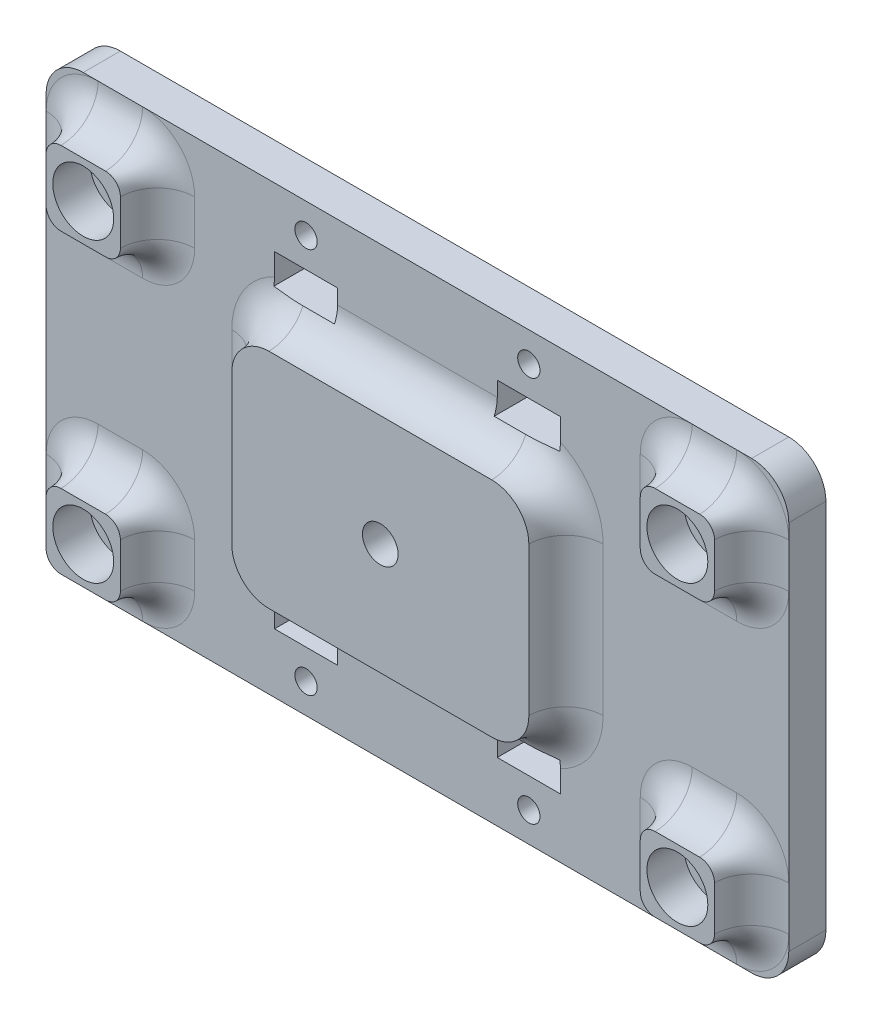
from build123d import *

# Parameters (mm, degrees)
SKETCH1_R           = 2.2500000000000027
SKETCH1_R_2         = 5
BOSS_EXTRUDE1_DEPTH = 5
SKETCH2_W           = 8.5
SKETCH2_H           = 4
CUT_EXTRUDE1_DEPTH  = 5
BOSS_EXTRUDE2_DEPTH = 5
SKETCH4_R           = 4.1000000000000005
CUT_EXTRUDE2_DEPTH  = 5
BOSS_EXTRUDE3_DEPTH = 5
SKETCH6_R           = 2.4
CUT_EXTRUDE3_DEPTH  = 5
FILLET1_R           = 5
SKETCH8_R           = 1.5000000000000009
SKETCH8_R_2         = 1.5000000000000042
SKETCH8_R_3         = 1.4999999999999973
CUT_EXTRUDE4_DEPTH  = 5


with BuildPart() as part:
    # Sketch1 → Boss-Extrude1 (new body)
    with BuildSketch(Plane.XY):
        with BuildLine():
            Line((-44.99999999999997, -30.000000000000004), (44.99999999999996, -30.000000000000004))
            ThreePointArc((44.99999999999996, -30.000000000000004), (48.53553390593273, -28.535533905932738), (49.99999999999999, -24.999999999999968))
            Line((49.99999999999999, -24.999999999999968), (49.99999999999999, 24.99999999999996))
            ThreePointArc((49.99999999999999, 24.99999999999996), (48.53553390593273, 28.53553390593273), (44.99999999999996, 29.999999999999996))
            Line((44.99999999999996, 29.999999999999996), (-44.99999999999997, 29.999999999999996))
            ThreePointArc((-44.99999999999997, 29.999999999999996), (-48.535533905932745, 28.535533905932727), (-50.00000000000001, 24.99999999999996))
            Line((-50.00000000000001, 24.99999999999996), (-50.00000000000001, -24.999999999999968))
            ThreePointArc((-50.00000000000001, -24.999999999999968), (-48.53553390593275, -28.535533905932745), (-44.99999999999997, -30.000000000000004))
        make_face()
        with Locations((-40.000000000000014, 19.999999999999993)):
            Circle(SKETCH1_R, mode=Mode.SUBTRACT)
        with Locations(Location((39.999999999999986, 19.999999999999993, 0), (0, 0, 180))):
            Circle(SKETCH1_R, mode=Mode.SUBTRACT)
        with Locations((39.999999999999986, -20.000000000000007)):
            Circle(SKETCH1_R, mode=Mode.SUBTRACT)
        with Locations(Location((-40.000000000000014, -20.000000000000007, 0), (0, 0, 180))):
            Circle(SKETCH1_R, mode=Mode.SUBTRACT)
        Circle(SKETCH1_R_2, mode=Mode.SUBTRACT)
    extrude(amount=BOSS_EXTRUDE1_DEPTH)

    # Sketch2 → Cut-Extrude1 (cut)
    with BuildSketch(Plane.XY.offset(5)):
        Polygon((10.750000000000002, -17.999999999999993), (19.250000000000007, -17.999999999999986), (19.250000000000007, -21.999999999999986), (10.750000000000005, -21.999999999999993), align=None)
        Polygon((-19.25, 19.999999999999993), (-19.25, 21.999999999999993), (-10.75, 21.999999999999993), (-10.75, 19.999999999999993), (-10.75, 17.999999999999996), (-19.25, 17.999999999999996), align=None)
        with Locations((15, 19.999999999999993)):
            Rectangle(SKETCH2_W, SKETCH2_H)
        Polygon((-19.249999999999993, -18.000000000000004), (-19.249999999999993, -20), (-19.249999999999993, -22), (-10.749999999999993, -21.999999999999993), (-10.749999999999996, -19.999999999999993), (-10.749999999999996, -17.999999999999996), align=None)
    extrude(amount=-CUT_EXTRUDE1_DEPTH, mode=Mode.SUBTRACT)

    # Sketch3 → Boss-Extrude2 (add)
    with BuildSketch(Plane.XY.offset(5)):
        with BuildLine():
            Line((-43, 14.999999999999998), (-37.00000000000003, 14.999999999999998))
            ThreePointArc((-37.00000000000003, 14.999999999999998), (-35.58578643762692, 15.585786437626902), (-35.00000000000001, 17.00000000000001))
            Line((-35.00000000000001, 17.00000000000001), (-35.00000000000001, 22.999999999999982))
            ThreePointArc((-35.00000000000001, 22.999999999999982), (-35.585786437626915, 24.4142135623731), (-37.00000000000003, 24.999999999999996))
            Line((-37.00000000000003, 24.999999999999996), (-43, 24.999999999999996))
            ThreePointArc((-43, 24.999999999999996), (-44.414213562373114, 24.414213562373096), (-45.000000000000014, 22.999999999999982))
            Line((-45.000000000000014, 22.999999999999982), (-45.000000000000014, 17.00000000000001))
            ThreePointArc((-45.000000000000014, 17.00000000000001), (-44.41421356237311, 15.585786437626904), (-43, 14.999999999999998))
        make_face()
        with BuildLine():
            Line((42.999999999999986, -15.000000000000005), (37.000000000000014, -15.000000000000005))
            ThreePointArc((37.000000000000014, -15.000000000000005), (35.58578643762691, -15.58578643762691), (34.99999999999999, -17.000000000000018))
            Line((34.99999999999999, -17.000000000000018), (34.99999999999999, -22.99999999999999))
            ThreePointArc((34.99999999999999, -22.99999999999999), (35.5857864376269, -24.414213562373106), (37.000000000000014, -25.000000000000004))
            Line((37.000000000000014, -25.000000000000004), (42.999999999999986, -25.000000000000004))
            ThreePointArc((42.999999999999986, -25.000000000000004), (44.4142135623731, -24.4142135623731), (45, -22.99999999999999))
            Line((45, -22.99999999999999), (45, -17.000000000000018))
            ThreePointArc((45, -17.000000000000018), (44.41421356237309, -15.58578643762691), (42.999999999999986, -15.000000000000005))
        make_face()
        with BuildLine():
            Line((34.99999999999999, 17.00000000000001), (34.99999999999999, 22.999999999999982))
            ThreePointArc((34.99999999999999, 22.999999999999982), (35.5857864376269, 24.4142135623731), (37.000000000000014, 24.999999999999996))
            Line((37.000000000000014, 24.999999999999996), (42.999999999999986, 24.999999999999996))
            ThreePointArc((42.999999999999986, 24.999999999999996), (44.4142135623731, 24.414213562373092), (45, 22.999999999999982))
            Line((45, 22.999999999999982), (45, 17.00000000000001))
            ThreePointArc((45, 17.00000000000001), (44.41421356237309, 15.585786437626902), (42.999999999999986, 14.999999999999998))
            Line((42.999999999999986, 14.999999999999998), (37.000000000000014, 14.999999999999998))
            ThreePointArc((37.000000000000014, 14.999999999999998), (35.58578643762691, 15.585786437626902), (34.99999999999999, 17.00000000000001))
        make_face()
        with BuildLine():
            Line((-35.00000000000001, -17.000000000000018), (-35.00000000000001, -22.99999999999999))
            ThreePointArc((-35.00000000000001, -22.99999999999999), (-35.585786437626915, -24.414213562373106), (-37.00000000000003, -25.000000000000004))
            Line((-37.00000000000003, -25.000000000000004), (-43, -25.000000000000004))
            ThreePointArc((-43, -25.000000000000004), (-44.414213562373114, -24.414213562373103), (-45.000000000000014, -22.99999999999999))
            Line((-45.000000000000014, -22.99999999999999), (-45.000000000000014, -17.000000000000018))
            ThreePointArc((-45.000000000000014, -17.000000000000018), (-44.41421356237311, -15.585786437626911), (-43, -15.000000000000005))
            Line((-43, -15.000000000000005), (-37.00000000000003, -15.000000000000005))
            ThreePointArc((-37.00000000000003, -15.000000000000005), (-35.58578643762692, -15.58578643762691), (-35.00000000000001, -17.000000000000018))
        make_face()
    extrude(amount=BOSS_EXTRUDE2_DEPTH)

    # Sketch4 → Cut-Extrude2 (cut)
    with BuildSketch(Plane.XY.offset(10)):
        with Locations((-40.00000000000001, 19.99999999999999)):
            Circle(SKETCH4_R)
        with Locations((39.99999999999999, 19.99999999999999)):
            Circle(SKETCH4_R)
        with Locations((39.99999999999999, -19.999999999999996)):
            Circle(SKETCH4_R)
        with Locations((-40.00000000000001, -19.999999999999996)):
            Circle(SKETCH4_R)
    extrude(amount=-CUT_EXTRUDE2_DEPTH, mode=Mode.SUBTRACT)

    # Sketch5 → Boss-Extrude3 (add)
    with BuildSketch(Plane.XY.offset(5)):
        with BuildLine():
            Line((-14.999999999999964, -14.999999999999998), (14.999999999999964, -14.999999999999998))
            ThreePointArc((14.999999999999964, -14.999999999999998), (18.535533905932738, -13.535533905932736), (20, -9.999999999999963))
            Line((20, -9.999999999999963), (20, 9.999999999999966))
            ThreePointArc((20, 9.999999999999966), (18.535533905932738, 13.53553390593274), (14.999999999999964, 15.000000000000002))
            Line((14.999999999999964, 15.000000000000002), (-14.999999999999964, 15.000000000000002))
            ThreePointArc((-14.999999999999964, 15.000000000000002), (-18.535533905932738, 13.535533905932738), (-20, 9.999999999999966))
            Line((-20, 9.999999999999966), (-20, -9.999999999999963))
            ThreePointArc((-20, -9.999999999999963), (-18.535533905932738, -13.535533905932736), (-14.999999999999964, -14.999999999999998))
        make_face()
    extrude(amount=BOSS_EXTRUDE3_DEPTH)

    # Sketch6 → Cut-Extrude3 (cut)
    with BuildSketch(Plane.XY.offset(10)):
        Circle(SKETCH6_R)
    extrude(amount=-CUT_EXTRUDE3_DEPTH, mode=Mode.SUBTRACT)

    # Fillet1
    # the kernel refuses this fillet: 5 mm, written as the material it adds along each edge
    with BuildSketch(Plane(origin=(37.00000000000001, 17.000000000000018, 5), x_dir=(3.55e-15, -1, 0), z_dir=(1, 3.55e-15, 0))) as fillet1_piece_1:
        with BuildLine():
            CenterArc((2.0000000000000178 + FILLET1_R, -FILLET1_R), FILLET1_R, 90, 90)
            Line((2.0000000000000178, -FILLET1_R), (2.0000000000000178, 0))
            Line((2.0000000000000178, 0), (2.0000000000000178 + FILLET1_R, 0))
        make_face()
    revolve(axis=Axis((37.00000000000001, 17.000000000000018, 5), (0, 0, -1)), revolution_arc=90)
    with BuildSketch(Plane(origin=(34.99999999999999, 17.00000000000001, 5), x_dir=(-1, 0, 0), z_dir=(0, 1, 0)), Plane(origin=(37.000000000000014, 24.999999999999996, 5), x_dir=(0, 1, 0), z_dir=(1, 0, 0)), Plane(origin=(45, 22.999999999999982, 5), x_dir=(1, 0, 0), z_dir=(0, -1, 0)), Plane(origin=(-45.000000000000014, -22.99999999999999, 5), x_dir=(-1, 0, 0), z_dir=(0, 1, 0)), Plane(origin=(-35.00000000000001, -17.000000000000018, 5), x_dir=(1, 0, 0), z_dir=(0, -1, 0)), Plane(origin=(-37.00000000000003, -25.000000000000004, 5), x_dir=(0, -1, 0), z_dir=(-1, 0, 0))) as fillet1_piece_2:
        with BuildLine():
            CenterArc((FILLET1_R, FILLET1_R), FILLET1_R, 180, 90)
            Line((0, FILLET1_R), (0, 0))
            Line((0, 0), (FILLET1_R, 0))
        make_face()
    extrude(amount=5.999999999999972)
    with BuildSketch(Plane(origin=(36.999999999999986, 23, 5), x_dir=(-1, -8.88e-15, 0), z_dir=(8.88e-15, -1, 0))) as fillet1_piece_3:
        with BuildLine():
            CenterArc((1.999999999999993 + FILLET1_R, -FILLET1_R), FILLET1_R, 90, 90)
            Line((1.999999999999993, -FILLET1_R), (1.999999999999993, 0))
            Line((1.999999999999993, 0), (1.999999999999993 + FILLET1_R, 0))
        make_face()
    revolve(axis=Axis((36.999999999999986, 23, 5), (0, 0, -1)), revolution_arc=90.00000000000132)
    with BuildSketch(Plane(origin=(43, 23.000000000000004, 5), x_dir=(-7.11e-15, 1, 0), z_dir=(-1, -7.11e-15, 0))) as fillet1_piece_4:
        with BuildLine():
            CenterArc((1.9999999999999964 + FILLET1_R, -FILLET1_R), FILLET1_R, 90, 90)
            Line((1.9999999999999964, -FILLET1_R), (1.9999999999999964, 0))
            Line((1.9999999999999964, 0), (1.9999999999999964 + FILLET1_R, 0))
        make_face()
    revolve(axis=Axis((43, 23.000000000000004, 5), (0, 0, -1)), revolution_arc=90.00000000000102)
    with BuildSketch(Plane(origin=(42.99999999999999, 17.000000000000004, 5), x_dir=(1, 3.55e-15, 0), z_dir=(-3.55e-15, 1, 0))) as fillet1_piece_5:
        with BuildLine():
            CenterArc((2.000000000000007 + FILLET1_R, -FILLET1_R), FILLET1_R, 90, 90)
            Line((2.000000000000007, -FILLET1_R), (2.000000000000007, 0))
            Line((2.000000000000007, 0), (2.000000000000007 + FILLET1_R, 0))
        make_face()
    revolve(axis=Axis((42.99999999999999, 17.000000000000004, 5), (0, 0, -1)), revolution_arc=90.00000000000041)
    with BuildSketch(Plane(origin=(36.999999999999986, -23.000000000000007, 5), x_dir=(-1, 8.88e-15, 0), z_dir=(8.88e-15, 1, 0))) as fillet1_piece_6:
        with BuildLine():
            CenterArc((1.999999999999993 + FILLET1_R, FILLET1_R), FILLET1_R, 180, 90)
            Line((1.999999999999993, FILLET1_R), (1.999999999999993, 0))
            Line((1.999999999999993, 0), (1.999999999999993 + FILLET1_R, 0))
        make_face()
    revolve(axis=Axis((36.999999999999986, -23.000000000000007, 5), (0, 0, 1)), revolution_arc=90.00000000000132)
    with BuildSketch(Plane(origin=(34.99999999999999, -17.000000000000018, 5), x_dir=(-1, 0, 0), z_dir=(0, -1, 0)), Plane(origin=(45, -22.99999999999999, 5), x_dir=(1, 0, 0), z_dir=(0, 1, 0)), Plane(origin=(-45.000000000000014, 22.999999999999982, 5), x_dir=(-1, 0, 0), z_dir=(0, -1, 0)), Plane(origin=(-37.00000000000003, 24.999999999999996, 5), x_dir=(0, 1, 0), z_dir=(-1, 0, 0)), Plane(origin=(-35.00000000000001, 17.00000000000001, 5), x_dir=(1, 0, 0), z_dir=(0, 1, 0)), Plane(origin=(37.000000000000014, -25.000000000000004, 5), x_dir=(0, -1, 0), z_dir=(1, 0, 0))) as fillet1_piece_7:
        with BuildLine():
            CenterArc((FILLET1_R, -FILLET1_R), FILLET1_R, 90, 90)
            Line((0, -FILLET1_R), (0, 0))
            Line((0, 0), (FILLET1_R, 0))
        make_face()
    extrude(amount=5.999999999999972)
    with BuildSketch(Plane(origin=(37.00000000000001, -17.000000000000025, 5), x_dir=(3.55e-15, 1, 0), z_dir=(1, -3.55e-15, 0))) as fillet1_piece_8:
        with BuildLine():
            CenterArc((2.0000000000000178 + FILLET1_R, FILLET1_R), FILLET1_R, 180, 90)
            Line((2.0000000000000178, FILLET1_R), (2.0000000000000178, 0))
            Line((2.0000000000000178, 0), (2.0000000000000178 + FILLET1_R, 0))
        make_face()
    revolve(axis=Axis((37.00000000000001, -17.000000000000025, 5), (0, 0, 1)), revolution_arc=90)
    with BuildSketch(Plane(origin=(42.999999999999986, -15.000000000000005, 5), x_dir=(0, 1, 0), z_dir=(-1, 0, 0)), Plane(origin=(-43, 14.999999999999998, 5), x_dir=(0, -1, 0), z_dir=(1, 0, 0))) as fillet1_piece_9:
        with BuildLine():
            CenterArc((FILLET1_R, -FILLET1_R), FILLET1_R, 90, 90)
            Line((-1.78e-15, -FILLET1_R), (0, 0))
            Line((0, 0), (FILLET1_R, 0))
        make_face()
    extrude(amount=5.999999999999972)
    with BuildSketch(Plane(origin=(42.99999999999999, -17.00000000000001, 5), x_dir=(1, -3.55e-15, 0), z_dir=(-3.55e-15, -1, 0))) as fillet1_piece_10:
        with BuildLine():
            CenterArc((2.000000000000007 + FILLET1_R, FILLET1_R), FILLET1_R, 180, 90)
            Line((2.000000000000007, FILLET1_R), (2.000000000000007, 0))
            Line((2.000000000000007, 0), (2.000000000000007 + FILLET1_R, 0))
        make_face()
    revolve(axis=Axis((42.99999999999999, -17.00000000000001, 5), (0, 0, 1)), revolution_arc=90.00000000000041)
    with BuildSketch(Plane(origin=(43, -23.00000000000001, 5), x_dir=(-7.11e-15, -1, 0), z_dir=(-1, 7.11e-15, 0))) as fillet1_piece_11:
        with BuildLine():
            CenterArc((1.9999999999999964 + FILLET1_R, FILLET1_R), FILLET1_R, 180, 90)
            Line((1.9999999999999964, FILLET1_R), (1.9999999999999964, 0))
            Line((1.9999999999999964, 0), (1.9999999999999964 + FILLET1_R, 0))
        make_face()
    revolve(axis=Axis((43, -23.00000000000001, 5), (0, 0, 1)), revolution_arc=90.00000000000102)
    with BuildSketch(Plane(origin=(-43.00000000000003, -23.000000000000014, 5), x_dir=(1.421e-14, -1, 0), z_dir=(1, 1.421e-14, 0))) as fillet1_piece_12:
        with BuildLine():
            CenterArc((1.9999999999999893 + FILLET1_R, -FILLET1_R), FILLET1_R, 90, 90)
            Line((1.9999999999999893, -FILLET1_R), (1.9999999999999893, 0))
            Line((1.9999999999999893, 0), (1.9999999999999893 + FILLET1_R, 0))
        make_face()
    revolve(axis=Axis((-43.00000000000003, -23.000000000000014, 5), (0, 0, -1)), revolution_arc=90.00000000000152)
    with BuildSketch(Plane(origin=(-43.00000000000001, -17.000000000000014, 5), x_dir=(-1, -1.78e-15, 0), z_dir=(1.78e-15, -1, 0))) as fillet1_piece_13:
        with BuildLine():
            CenterArc((2.000000000000007 + FILLET1_R, -FILLET1_R), FILLET1_R, 90, 90)
            Line((2.000000000000007, -FILLET1_R), (2.000000000000007, 0))
            Line((2.000000000000007, 0), (2.000000000000007 + FILLET1_R, 0))
        make_face()
    revolve(axis=Axis((-43.00000000000001, -17.000000000000014, 5), (0, 0, -1)), revolution_arc=90.0000000000003)
    with BuildSketch(Plane(origin=(-43, -15.000000000000005, 5), x_dir=(0, 1, 0), z_dir=(1, 0, 0)), Plane(origin=(42.999999999999986, 14.999999999999998, 5), x_dir=(0, -1, 0), z_dir=(-1, 0, 0))) as fillet1_piece_14:
        with BuildLine():
            CenterArc((FILLET1_R, FILLET1_R), FILLET1_R, 180, 90)
            Line((-1.78e-15, FILLET1_R), (0, 0))
            Line((0, 0), (FILLET1_R, 0))
        make_face()
    extrude(amount=5.999999999999972)
    with BuildSketch(Plane(origin=(-37.00000000000002, -17.000000000000025, 5), x_dir=(-3.55e-15, 1, 0), z_dir=(-1, -3.55e-15, 0))) as fillet1_piece_15:
        with BuildLine():
            CenterArc((2.0000000000000178 + FILLET1_R, -FILLET1_R), FILLET1_R, 90, 90)
            Line((2.0000000000000178, -FILLET1_R), (2.0000000000000178, 0))
            Line((2.0000000000000178, 0), (2.0000000000000178 + FILLET1_R, 0))
        make_face()
    revolve(axis=Axis((-37.00000000000002, -17.000000000000025, 5), (0, 0, -1)), revolution_arc=90)
    with BuildSketch(Plane(origin=(-37, -23.000000000000007, 5), x_dir=(1, 8.88e-15, 0), z_dir=(-8.88e-15, 1, 0))) as fillet1_piece_16:
        with BuildLine():
            CenterArc((1.999999999999993 + FILLET1_R, -FILLET1_R), FILLET1_R, 90, 90)
            Line((1.999999999999993, -FILLET1_R), (1.999999999999993, 0))
            Line((1.999999999999993, 0), (1.999999999999993 + FILLET1_R, 0))
        make_face()
    revolve(axis=Axis((-37, -23.000000000000007, 5), (0, 0, -1)), revolution_arc=90.00000000000132)
    with BuildSketch(Plane(origin=(-43.00000000000001, 17.000000000000007, 5), x_dir=(-1, 1.78e-15, 0), z_dir=(1.78e-15, 1, 0))) as fillet1_piece_17:
        with BuildLine():
            CenterArc((2.000000000000007 + FILLET1_R, FILLET1_R), FILLET1_R, 180, 90)
            Line((2.000000000000007, FILLET1_R), (2.000000000000007, 0))
            Line((2.000000000000007, 0), (2.000000000000007 + FILLET1_R, 0))
        make_face()
    revolve(axis=Axis((-43.00000000000001, 17.000000000000007, 5), (0, 0, 1)), revolution_arc=90.0000000000003)
    with BuildSketch(Plane(origin=(-43.00000000000003, 23.000000000000007, 5), x_dir=(1.421e-14, 1, 0), z_dir=(1, -1.421e-14, 0))) as fillet1_piece_18:
        with BuildLine():
            CenterArc((1.9999999999999893 + FILLET1_R, FILLET1_R), FILLET1_R, 180, 90)
            Line((1.9999999999999893, FILLET1_R), (1.9999999999999893, 0))
            Line((1.9999999999999893, 0), (1.9999999999999893 + FILLET1_R, 0))
        make_face()
    revolve(axis=Axis((-43.00000000000003, 23.000000000000007, 5), (0, 0, 1)), revolution_arc=90.00000000000152)
    with BuildSketch(Plane(origin=(-37, 23, 5), x_dir=(1, -8.88e-15, 0), z_dir=(-8.88e-15, -1, 0))) as fillet1_piece_19:
        with BuildLine():
            CenterArc((1.999999999999993 + FILLET1_R, FILLET1_R), FILLET1_R, 180, 90)
            Line((1.999999999999993, FILLET1_R), (1.999999999999993, 0))
            Line((1.999999999999993, 0), (1.999999999999993 + FILLET1_R, 0))
        make_face()
    revolve(axis=Axis((-37, 23, 5), (0, 0, 1)), revolution_arc=90.00000000000132)
    with BuildSketch(Plane(origin=(-37.00000000000002, 17.000000000000018, 5), x_dir=(-3.55e-15, -1, 0), z_dir=(-1, 3.55e-15, 0))) as fillet1_piece_20:
        with BuildLine():
            CenterArc((2.0000000000000178 + FILLET1_R, FILLET1_R), FILLET1_R, 180, 90)
            Line((2.0000000000000178, FILLET1_R), (2.0000000000000178, 0))
            Line((2.0000000000000178, 0), (2.0000000000000178 + FILLET1_R, 0))
        make_face()
    revolve(axis=Axis((-37.00000000000002, 17.000000000000018, 5), (0, 0, 1)), revolution_arc=90)
    with BuildSketch(Plane(origin=(-14.999999999999998, 9.999999999999998, 5), x_dir=(6.75e-15, 1, 0), z_dir=(1, -6.75e-15, 0))) as fillet1_piece_21_section:
        with BuildLine():
            CenterArc((5.000000000000002 + FILLET1_R, FILLET1_R), FILLET1_R, 180, 90)
            Line((5.000000000000002, FILLET1_R), (5.000000000000002, 0))
            Line((5.000000000000002, 0), (5.000000000000002 + FILLET1_R, 0))
        make_face()
    fillet1_piece_21 = revolve(axis=Axis((-14.999999999999998, 9.999999999999998, 5), (0, 0, 1)), revolution_arc=90.00000000000075, mode=Mode.PRIVATE)
    fillet1_piece_21 = split(fillet1_piece_21, bisect_by=Plane(origin=(-17.281539778708495, 17.999999999999996, 6.218302554788769), z_dir=(0, -1, 0)), keep=Keep.TOP, mode=Mode.PRIVATE)
    fillet1_piece_21 = split(fillet1_piece_21, bisect_by=Plane(origin=(-19.25, 15.302097192491152, 6.218302554788769), z_dir=(1, 0, 0)), keep=Keep.TOP, mode=Mode.PRIVATE)
    add(fillet1_piece_21)
    with BuildSketch(Plane(origin=(-14.999999999999998, 9.999999999999998, 5), x_dir=(6.75e-15, 1, 0), z_dir=(1, -6.75e-15, 0))) as fillet1_piece_22_section:
        with BuildLine():
            CenterArc((5.000000000000002 + FILLET1_R, FILLET1_R), FILLET1_R, 180, 90)
            Line((5.000000000000002, FILLET1_R), (5.000000000000002, 0))
            Line((5.000000000000002, 0), (5.000000000000002 + FILLET1_R, 0))
        make_face()
    fillet1_piece_22 = revolve(axis=Axis((-14.999999999999998, 9.999999999999998, 5), (0, 0, 1)), revolution_arc=90.00000000000075, mode=Mode.PRIVATE)
    fillet1_piece_22 = split(fillet1_piece_22, bisect_by=Plane(origin=(-19.824185959083827, 17.999999999999996, 4.958985254354529), z_dir=(0, 1, 0)), keep=Keep.TOP, mode=Mode.PRIVATE)
    fillet1_piece_22 = split(fillet1_piece_22, bisect_by=Plane(origin=(-19.25, 18.344886608828045, 4.958985254354529), z_dir=(-1, 0, 0)), keep=Keep.TOP, mode=Mode.PRIVATE)
    add(fillet1_piece_22)
    with BuildSketch(Plane(origin=(-14.999999999999998, 9.999999999999998, 5), x_dir=(6.75e-15, 1, 0), z_dir=(1, -6.75e-15, 0))) as fillet1_piece_23_section:
        with BuildLine():
            CenterArc((5.000000000000002 + FILLET1_R, FILLET1_R), FILLET1_R, 180, 90)
            Line((5.000000000000002, FILLET1_R), (5.000000000000002, 0))
            Line((5.000000000000002, 0), (5.000000000000002 + FILLET1_R, 0))
        make_face()
    fillet1_piece_23 = revolve(axis=Axis((-14.999999999999998, 9.999999999999998, 5), (0, 0, 1)), revolution_arc=90.00000000000075, mode=Mode.PRIVATE)
    fillet1_piece_23 = split(fillet1_piece_23, bisect_by=Plane(origin=(-20.764281558512828, 17.999999999999996, 5.8842057196890725), z_dir=(0, -1, 0)), keep=Keep.TOP, mode=Mode.PRIVATE)
    fillet1_piece_23 = split(fillet1_piece_23, bisect_by=Plane(origin=(-19.25, 12.592439200235301, 5.8842057196890725), z_dir=(-1, 0, 0)), keep=Keep.TOP, mode=Mode.PRIVATE)
    add(fillet1_piece_23)
    with BuildSketch(Plane(origin=(14.999999999999964, 15.000000000000002, 5), x_dir=(0, 1, 0), z_dir=(-1, 0, 0))) as fillet1_piece_24_section:
        with BuildLine():
            CenterArc((FILLET1_R, -FILLET1_R), FILLET1_R, 90, 90)
            Line((-1.78e-15, -FILLET1_R), (0, 0))
            Line((0, 0), (FILLET1_R, 0))
        make_face()
    fillet1_piece_24 = extrude(amount=29.99999999999993, mode=Mode.PRIVATE)
    fillet1_piece_24 = split(fillet1_piece_24, bisect_by=Plane(origin=(12.874999999999979, 17.999999999999996, 6.218725877705305), z_dir=(0, -1, 0)), keep=Keep.TOP, mode=Mode.PRIVATE)
    fillet1_piece_24 = split(fillet1_piece_24, bisect_by=Plane(origin=(10.75, 15.92525031797187, 6.218725877705305), z_dir=(1, 0, 0)), keep=Keep.TOP, mode=Mode.PRIVATE)
    add(fillet1_piece_24)
    with BuildSketch(Plane(origin=(14.999999999999964, 15.000000000000002, 5), x_dir=(0, 1, 0), z_dir=(-1, 0, 0))) as fillet1_piece_25_section:
        with BuildLine():
            CenterArc((FILLET1_R, -FILLET1_R), FILLET1_R, 90, 90)
            Line((-1.78e-15, -FILLET1_R), (0, 0))
            Line((0, 0), (FILLET1_R, 0))
        make_face()
    fillet1_piece_25 = extrude(amount=29.99999999999993, mode=Mode.PRIVATE)
    fillet1_piece_25 = split(fillet1_piece_25, bisect_by=Plane(origin=(-1.421e-14, 17.999999999999996, 5.05065923995903), z_dir=(0, 1, 0)), keep=Keep.TOP, mode=Mode.PRIVATE)
    fillet1_piece_25 = split(fillet1_piece_25, bisect_by=Plane(origin=(-10.75, 18.7087433306528, 5.05065923995903), z_dir=(1, 0, 0)), keep=Keep.TOP, mode=Mode.PRIVATE)
    fillet1_piece_25 = split(fillet1_piece_25, bisect_by=Plane(origin=(10.75, 18.7087433306528, 5.05065923995903), z_dir=(-1, 0, 0)), keep=Keep.TOP, mode=Mode.PRIVATE)
    add(fillet1_piece_25)
    with BuildSketch(Plane(origin=(14.999999999999964, 15.000000000000002, 5), x_dir=(0, 1, 0), z_dir=(-1, 0, 0))) as fillet1_piece_26_section:
        with BuildLine():
            CenterArc((FILLET1_R, -FILLET1_R), FILLET1_R, 90, 90)
            Line((-1.78e-15, -FILLET1_R), (0, 0))
            Line((0, 0), (FILLET1_R, 0))
        make_face()
    fillet1_piece_26 = extrude(amount=29.99999999999993, mode=Mode.PRIVATE)
    fillet1_piece_26 = split(fillet1_piece_26, bisect_by=Plane(origin=(1.78e-15, 17.999999999999996, 6.218725877705304), z_dir=(0, -1, 0)), keep=Keep.TOP, mode=Mode.PRIVATE)
    fillet1_piece_26 = split(fillet1_piece_26, bisect_by=Plane(origin=(-10.75, 15.925250317971868, 6.218725877705304), z_dir=(1, 0, 0)), keep=Keep.TOP, mode=Mode.PRIVATE)
    fillet1_piece_26 = split(fillet1_piece_26, bisect_by=Plane(origin=(10.75, 15.925250317971868, 6.218725877705304), z_dir=(-1, 0, 0)), keep=Keep.TOP, mode=Mode.PRIVATE)
    add(fillet1_piece_26)
    with BuildSketch(Plane(origin=(14.999999999999964, 15.000000000000002, 5), x_dir=(0, 1, 0), z_dir=(-1, 0, 0))) as fillet1_piece_27_section:
        with BuildLine():
            CenterArc((FILLET1_R, -FILLET1_R), FILLET1_R, 90, 90)
            Line((-1.78e-15, -FILLET1_R), (0, 0))
            Line((0, 0), (FILLET1_R, 0))
        make_face()
    fillet1_piece_27 = extrude(amount=29.99999999999993, mode=Mode.PRIVATE)
    fillet1_piece_27 = split(fillet1_piece_27, bisect_by=Plane(origin=(-12.874999999999984, 17.999999999999996, 6.218725877705306), z_dir=(0, -1, 0)), keep=Keep.TOP, mode=Mode.PRIVATE)
    fillet1_piece_27 = split(fillet1_piece_27, bisect_by=Plane(origin=(-10.75, 15.925250317971866, 6.218725877705306), z_dir=(-1, 0, 0)), keep=Keep.TOP, mode=Mode.PRIVATE)
    add(fillet1_piece_27)
    with BuildSketch(Plane(origin=(15, 10, 5), x_dir=(1, -6.75e-15, 0), z_dir=(-6.75e-15, -1, 0))) as fillet1_piece_28_section:
        with BuildLine():
            CenterArc((5 + FILLET1_R, FILLET1_R), FILLET1_R, 180, 90)
            Line((5, FILLET1_R), (5, 0))
            Line((5, 0), (5 + FILLET1_R, 0))
        make_face()
    fillet1_piece_28 = revolve(axis=Axis((15, 10, 5), (0, 0, 1)), revolution_arc=90.0000000000008, mode=Mode.PRIVATE)
    fillet1_piece_28 = split(fillet1_piece_28, bisect_by=Plane(origin=(20.76428210944322, 17.999999999999993, 5.88420553416653), z_dir=(0, -1, 0)), keep=Keep.TOP, mode=Mode.PRIVATE)
    fillet1_piece_28 = split(fillet1_piece_28, bisect_by=Plane(origin=(19.25, 12.592439229592191, 5.88420553416653), z_dir=(1, 0, 0)), keep=Keep.TOP, mode=Mode.PRIVATE)
    add(fillet1_piece_28)
    with BuildSketch(Plane(origin=(15, 10, 5), x_dir=(1, -6.75e-15, 0), z_dir=(-6.75e-15, -1, 0))) as fillet1_piece_29_section:
        with BuildLine():
            CenterArc((5 + FILLET1_R, FILLET1_R), FILLET1_R, 180, 90)
            Line((5, FILLET1_R), (5, 0))
            Line((5, 0), (5 + FILLET1_R, 0))
        make_face()
    fillet1_piece_29 = revolve(axis=Axis((15, 10, 5), (0, 0, 1)), revolution_arc=90.0000000000008, mode=Mode.PRIVATE)
    fillet1_piece_29 = split(fillet1_piece_29, bisect_by=Plane(origin=(17.281539697672972, 17.999999999999993, 6.21830244425351), z_dir=(0, -1, 0)), keep=Keep.TOP, mode=Mode.PRIVATE)
    fillet1_piece_29 = split(fillet1_piece_29, bisect_by=Plane(origin=(19.25, 15.30209718062993, 6.21830244425351), z_dir=(-1, 0, 0)), keep=Keep.TOP, mode=Mode.PRIVATE)
    add(fillet1_piece_29)
    with BuildSketch(Plane(origin=(15, 10, 5), x_dir=(1, -6.75e-15, 0), z_dir=(-6.75e-15, -1, 0))) as fillet1_piece_30_section:
        with BuildLine():
            CenterArc((5 + FILLET1_R, FILLET1_R), FILLET1_R, 180, 90)
            Line((5, FILLET1_R), (5, 0))
            Line((5, 0), (5 + FILLET1_R, 0))
        make_face()
    fillet1_piece_30 = revolve(axis=Axis((15, 10, 5), (0, 0, 1)), revolution_arc=90.0000000000008, mode=Mode.PRIVATE)
    fillet1_piece_30 = split(fillet1_piece_30, bisect_by=Plane(origin=(19.824186175633812, 17.999999999999993, 4.958985185334396), z_dir=(0, 1, 0)), keep=Keep.TOP, mode=Mode.PRIVATE)
    fillet1_piece_30 = split(fillet1_piece_30, bisect_by=Plane(origin=(19.25, 18.344886735711, 4.958985185334396), z_dir=(1, 0, 0)), keep=Keep.TOP, mode=Mode.PRIVATE)
    add(fillet1_piece_30)
    with BuildSketch(Plane(origin=(20, -9.999999999999963, 5), x_dir=(1, 0, 0), z_dir=(0, 1, 0)), Plane(origin=(-20, 9.999999999999966, 5), x_dir=(-1, 0, 0), z_dir=(0, -1, 0))) as fillet1_piece_31:
        with BuildLine():
            CenterArc((FILLET1_R, -FILLET1_R), FILLET1_R, 90, 90)
            Line((0, -FILLET1_R), (0, 0))
            Line((0, 0), (FILLET1_R, 0))
        make_face()
    extrude(amount=19.99999999999993)
    with BuildSketch(Plane(origin=(15, -9.999999999999996, 5), x_dir=(-7.11e-15, -1, 0), z_dir=(-1, 7.11e-15, 0))) as fillet1_piece_32_section:
        with BuildLine():
            CenterArc((5 + FILLET1_R, FILLET1_R), FILLET1_R, 180, 90)
            Line((5, FILLET1_R), (5, 0))
            Line((5, 0), (5 + FILLET1_R, 0))
        make_face()
    fillet1_piece_32 = revolve(axis=Axis((15, -9.999999999999996, 5), (0, 0, 1)), revolution_arc=90.0000000000008, mode=Mode.PRIVATE)
    fillet1_piece_32 = split(fillet1_piece_32, bisect_by=Plane(origin=(17.2815397787085, -17.999999999999986, 6.2183025547887985), z_dir=(-8.4e-16, 1, 0)), keep=Keep.TOP, mode=Mode.PRIVATE)
    fillet1_piece_32 = split(fillet1_piece_32, bisect_by=Plane(origin=(19.250000000000007, -15.30209719249103, 6.2183025547887985), z_dir=(-1, 0, 0)), keep=Keep.TOP, mode=Mode.PRIVATE)
    add(fillet1_piece_32)
    with BuildSketch(Plane(origin=(15, -9.999999999999996, 5), x_dir=(-7.11e-15, -1, 0), z_dir=(-1, 7.11e-15, 0))) as fillet1_piece_33_section:
        with BuildLine():
            CenterArc((5 + FILLET1_R, FILLET1_R), FILLET1_R, 180, 90)
            Line((5, FILLET1_R), (5, 0))
            Line((5, 0), (5 + FILLET1_R, 0))
        make_face()
    fillet1_piece_33 = revolve(axis=Axis((15, -9.999999999999996, 5), (0, 0, 1)), revolution_arc=90.0000000000008, mode=Mode.PRIVATE)
    fillet1_piece_33 = split(fillet1_piece_33, bisect_by=Plane(origin=(19.82418595908383, -17.999999999999986, 4.9589852543545305), z_dir=(8.4e-16, -1, 0)), keep=Keep.TOP, mode=Mode.PRIVATE)
    fillet1_piece_33 = split(fillet1_piece_33, bisect_by=Plane(origin=(19.250000000000007, -18.344886608828034, 4.9589852543545305), z_dir=(1, 0, 0)), keep=Keep.TOP, mode=Mode.PRIVATE)
    add(fillet1_piece_33)
    with BuildSketch(Plane(origin=(15, -9.999999999999996, 5), x_dir=(-7.11e-15, -1, 0), z_dir=(-1, 7.11e-15, 0))) as fillet1_piece_34_section:
        with BuildLine():
            CenterArc((5 + FILLET1_R, FILLET1_R), FILLET1_R, 180, 90)
            Line((5, FILLET1_R), (5, 0))
            Line((5, 0), (5 + FILLET1_R, 0))
        make_face()
    fillet1_piece_34 = revolve(axis=Axis((15, -9.999999999999996, 5), (0, 0, 1)), revolution_arc=90.0000000000008, mode=Mode.PRIVATE)
    fillet1_piece_34 = split(fillet1_piece_34, bisect_by=Plane(origin=(20.764281558512835, -17.999999999999986, 5.88420571968907), z_dir=(-8.4e-16, 1, 0)), keep=Keep.TOP, mode=Mode.PRIVATE)
    fillet1_piece_34 = split(fillet1_piece_34, bisect_by=Plane(origin=(19.250000000000007, -12.592439200235292, 5.88420571968907), z_dir=(1, 0, 0)), keep=Keep.TOP, mode=Mode.PRIVATE)
    add(fillet1_piece_34)
    with BuildSketch(Plane(origin=(-14.999999999999964, -14.999999999999998, 5), x_dir=(0, -1, 0), z_dir=(1, 0, 0))) as fillet1_piece_35_section:
        with BuildLine():
            CenterArc((FILLET1_R, -FILLET1_R), FILLET1_R, 90, 90)
            Line((-1.78e-15, -FILLET1_R), (0, 0))
            Line((0, 0), (FILLET1_R, 0))
        make_face()
    fillet1_piece_35 = extrude(amount=29.99999999999993, mode=Mode.PRIVATE)
    fillet1_piece_35 = split(fillet1_piece_35, bisect_by=Plane(origin=(-10.750000000000004, -15.925250317971857, 6.218725877705305), z_dir=(-1, -1.78e-15, 0)), keep=Keep.TOP, mode=Mode.PRIVATE)
    fillet1_piece_35 = split(fillet1_piece_35, bisect_by=Plane(origin=(-12.874999999999982, -17.999999999999996, 6.218725877705305), z_dir=(-8.4e-16, 1, 0)), keep=Keep.TOP, mode=Mode.PRIVATE)
    add(fillet1_piece_35)
    with BuildSketch(Plane(origin=(-14.999999999999964, -14.999999999999998, 5), x_dir=(0, -1, 0), z_dir=(1, 0, 0))) as fillet1_piece_36_section:
        with BuildLine():
            CenterArc((FILLET1_R, -FILLET1_R), FILLET1_R, 90, 90)
            Line((-1.78e-15, -FILLET1_R), (0, 0))
            Line((0, 0), (FILLET1_R, 0))
        make_face()
    fillet1_piece_36 = extrude(amount=29.99999999999993, mode=Mode.PRIVATE)
    fillet1_piece_36 = split(fillet1_piece_36, bisect_by=Plane(origin=(-10.749999999999998, -18.708743330652815, 5.05065923995903), z_dir=(1, 1.78e-15, 0)), keep=Keep.TOP, mode=Mode.PRIVATE)
    fillet1_piece_36 = split(fillet1_piece_36, bisect_by=Plane(origin=(2.487e-14, -17.999999999999986, 5.05065923995903), z_dir=(8.4e-16, -1, 0)), keep=Keep.TOP, mode=Mode.PRIVATE)
    fillet1_piece_36 = split(fillet1_piece_36, bisect_by=Plane(origin=(10.750000000000002, -18.708743330652787, 5.05065923995903), z_dir=(-1, -8.9e-16, 0)), keep=Keep.TOP, mode=Mode.PRIVATE)
    add(fillet1_piece_36)
    with BuildSketch(Plane(origin=(-14.999999999999964, -14.999999999999998, 5), x_dir=(0, -1, 0), z_dir=(1, 0, 0))) as fillet1_piece_37_section:
        with BuildLine():
            CenterArc((FILLET1_R, -FILLET1_R), FILLET1_R, 90, 90)
            Line((-1.78e-15, -FILLET1_R), (0, 0))
            Line((0, 0), (FILLET1_R, 0))
        make_face()
    fillet1_piece_37 = extrude(amount=29.99999999999993, mode=Mode.PRIVATE)
    fillet1_piece_37 = split(fillet1_piece_37, bisect_by=Plane(origin=(-10.750000000000004, -15.925250317971878, 6.218725877705305), z_dir=(1, 1.78e-15, 0)), keep=Keep.TOP, mode=Mode.PRIVATE)
    fillet1_piece_37 = split(fillet1_piece_37, bisect_by=Plane(origin=(-3.55e-15, -17.999999999999986, 6.218725877705305), z_dir=(-8.4e-16, 1, 0)), keep=Keep.TOP, mode=Mode.PRIVATE)
    fillet1_piece_37 = split(fillet1_piece_37, bisect_by=Plane(origin=(10.75, -15.92525031797185, 6.218725877705305), z_dir=(-1, -8.9e-16, 0)), keep=Keep.TOP, mode=Mode.PRIVATE)
    add(fillet1_piece_37)
    with BuildSketch(Plane(origin=(-14.999999999999964, -14.999999999999998, 5), x_dir=(0, -1, 0), z_dir=(1, 0, 0))) as fillet1_piece_38_section:
        with BuildLine():
            CenterArc((FILLET1_R, -FILLET1_R), FILLET1_R, 90, 90)
            Line((-1.78e-15, -FILLET1_R), (0, 0))
            Line((0, 0), (FILLET1_R, 0))
        make_face()
    fillet1_piece_38 = extrude(amount=29.99999999999993, mode=Mode.PRIVATE)
    fillet1_piece_38 = split(fillet1_piece_38, bisect_by=Plane(origin=(12.874999999999986, -17.999999999999975, 6.218725877705306), z_dir=(-8.4e-16, 1, 0)), keep=Keep.TOP, mode=Mode.PRIVATE)
    fillet1_piece_38 = split(fillet1_piece_38, bisect_by=Plane(origin=(10.75, -15.925250317971857, 6.218725877705306), z_dir=(1, 8.9e-16, 0)), keep=Keep.TOP, mode=Mode.PRIVATE)
    add(fillet1_piece_38)
    with BuildSketch(Plane(origin=(-15, -9.999999999999996, 5), x_dir=(-1, 6.75e-15, 0), z_dir=(6.75e-15, 1, 0))) as fillet1_piece_39_section:
        with BuildLine():
            CenterArc((5 + FILLET1_R, FILLET1_R), FILLET1_R, 180, 90)
            Line((5, FILLET1_R), (5, 0))
            Line((5, 0), (5 + FILLET1_R, 0))
        make_face()
    fillet1_piece_39 = revolve(axis=Axis((-15, -9.999999999999996, 5), (0, 0, 1)), revolution_arc=90.0000000000008, mode=Mode.PRIVATE)
    fillet1_piece_39 = split(fillet1_piece_39, bisect_by=Plane(origin=(-19.249999999999993, -12.592439517395597, 5.884205585825057), z_dir=(-1, 0, 0)), keep=Keep.TOP, mode=Mode.PRIVATE)
    fillet1_piece_39 = split(fillet1_piece_39, bisect_by=Plane(origin=(-20.764282048920442, -18.000000000000004, 5.884205585825057), z_dir=(-8.4e-16, 1, 0)), keep=Keep.TOP, mode=Mode.PRIVATE)
    add(fillet1_piece_39)
    with BuildSketch(Plane(origin=(-15, -9.999999999999996, 5), x_dir=(-1, 6.75e-15, 0), z_dir=(6.75e-15, 1, 0))) as fillet1_piece_40_section:
        with BuildLine():
            CenterArc((5 + FILLET1_R, FILLET1_R), FILLET1_R, 180, 90)
            Line((5, FILLET1_R), (5, 0))
            Line((5, 0), (5 + FILLET1_R, 0))
        make_face()
    fillet1_piece_40 = revolve(axis=Axis((-15, -9.999999999999996, 5), (0, 0, 1)), revolution_arc=90.0000000000008, mode=Mode.PRIVATE)
    fillet1_piece_40 = split(fillet1_piece_40, bisect_by=Plane(origin=(-19.249999999999993, -15.302097182863854, 6.218302554812273), z_dir=(1, 0, 0)), keep=Keep.TOP, mode=Mode.PRIVATE)
    fillet1_piece_40 = split(fillet1_piece_40, bisect_by=Plane(origin=(-17.28153976403579, -18.000000000000004, 6.218302554812273), z_dir=(-8.4e-16, 1, 0)), keep=Keep.TOP, mode=Mode.PRIVATE)
    add(fillet1_piece_40)
    with BuildSketch(Plane(origin=(-15, -9.999999999999996, 5), x_dir=(-1, 6.75e-15, 0), z_dir=(6.75e-15, 1, 0))) as fillet1_piece_41_section:
        with BuildLine():
            CenterArc((5 + FILLET1_R, FILLET1_R), FILLET1_R, 180, 90)
            Line((5, FILLET1_R), (5, 0))
            Line((5, 0), (5 + FILLET1_R, 0))
        make_face()
    fillet1_piece_41 = revolve(axis=Axis((-15, -9.999999999999996, 5), (0, 0, 1)), revolution_arc=90.0000000000008, mode=Mode.PRIVATE)
    fillet1_piece_41 = split(fillet1_piece_41, bisect_by=Plane(origin=(-19.249999999999993, -18.34488660768298, 4.958985254595876), z_dir=(-1, 0, 0)), keep=Keep.TOP, mode=Mode.PRIVATE)
    fillet1_piece_41 = split(fillet1_piece_41, bisect_by=Plane(origin=(-19.82418595888638, -18.000000000000004, 4.958985254595876), z_dir=(8.4e-16, -1, 0)), keep=Keep.TOP, mode=Mode.PRIVATE)
    add(fillet1_piece_41)

    # Sketch8 → Cut-Extrude4 (cut)
    with BuildSketch(Plane.XY.offset(5)):
        with Locations((15, 25.999999999999993)):
            Circle(SKETCH8_R)
        with Locations((15.000000000000007, -25.999999999999993)):
            Circle(SKETCH8_R)
        with Locations((-15.000000000000016, -25.99999999999998)):
            Circle(SKETCH8_R_2)
        with Locations((-14.999999999999975, 26.000000000000004)):
            Circle(SKETCH8_R_3)
    extrude(amount=-CUT_EXTRUDE4_DEPTH, mode=Mode.SUBTRACT)


solid = part.part
